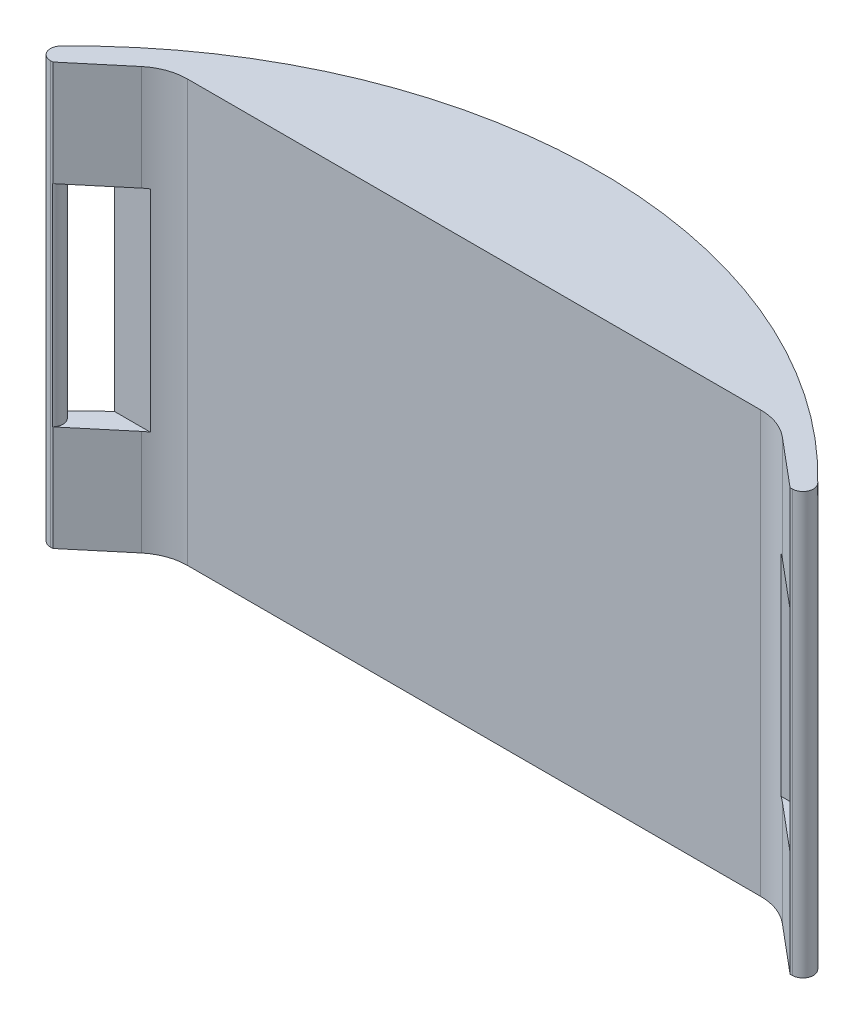
from build123d import *

# Parameters (mm, degrees)
EXTRUDE_4_DEPTH     = 80
CUT_EXTRUDE_1_DEPTH = 80
FILLET_3_R          = 2
FILLET_4_R          = 2
CUT_EXTRUDE_2_DEPTH = 90
CUT_EXTRUDE_3_DEPTH = 90
FILLET_5_R          = 2
FILLET_6_R          = 2


with BuildPart() as part:
    # 草图1 → 凸台-拉伸4 (new body)
    with BuildSketch(Plane(origin=(0, 0, 0), x_dir=(1, 0, 0), z_dir=(0, 1, 0))):
        with BuildLine():
            Line((-58.430824656, -54.95766375), (91.569175344, -54.95766375))
            ThreePointArc((91.569175344, -54.95766375), (16.569175344, -21.101446527), (-58.430824656, -54.95766375))
        make_face()
    extrude(amount=EXTRUDE_4_DEPTH)

    # 草图6 → 切除-拉伸1 (cut)
    with BuildSketch(Plane(origin=(0, 80, 0), x_dir=(1, 0, 0), z_dir=(0, 1, 0))):
        with BuildLine():
            Line((16.569175344, -54.95766375), (-53.430824656, -54.95766375))
            Line((-53.430824656, -54.95766375), (-44.284141383, -47.292975133))
            ThreePointArc((-44.284141383, -47.292975133), (-41.278424436, -45.559608468), (-37.861326704, -44.95766375))
            Line((-37.861326704, -44.95766375), (16.569175344, -44.95766375))
            Line((16.569175344, -44.95766375), (70.999677391, -44.95766375))
            ThreePointArc((70.999677391, -44.95766375), (74.416775124, -45.559608468), (77.422492071, -47.292975133))
            Line((77.422492071, -47.292975133), (86.569175344, -54.95766375))
            Line((86.569175344, -54.95766375), (16.569175344, -54.95766375))
        make_face()
    extrude(amount=-CUT_EXTRUDE_1_DEPTH, mode=Mode.SUBTRACT)

    # 圆角3
    fillet_3_edges = [part.edges().sort_by_distance(p)[0] for p in [
        (-58.430824656, 40, 54.95766375),
    ]]
    fillet(fillet_3_edges, radius=FILLET_3_R)

    # 圆角4
    fillet_4_edges = [part.edges().sort_by_distance(p)[0] for p in [
        (91.569175344, 40, 54.95766375),
    ]]
    fillet(fillet_4_edges, radius=FILLET_4_R)

    # 草图7 → 切除-拉伸2 (cut, symmetric)
    with BuildSketch(Plane(origin=(0, 0, 0), x_dir=(0, 0, -1), z_dir=(1, 0, 0))):
        Polygon((-34.95766375, 20), (-21.101446527, 20), (-21.101446527, 60), (-34.95766375, 60), (-34.95766375, 40), align=None)
    extrude(amount=CUT_EXTRUDE_2_DEPTH, both=True, mode=Mode.SUBTRACT)

    # 草图8 → 切除-拉伸3 (cut, symmetric)
    with BuildSketch(Plane(origin=(0, 0, 0), x_dir=(0, 0, -1), z_dir=(1, 0, 0))):
        Polygon((-46.566974306, 40), (-46.566974306, 20), (-51.566974306, 20), (-51.566974306, 40), (-51.566974306, 60), (-46.566974306, 60), align=None)
    extrude(amount=CUT_EXTRUDE_3_DEPTH, both=True, mode=Mode.SUBTRACT)

    # 圆角5
    # the kernel refuses this fillet: 2 mm, written as the material it takes off along each edge
    with BuildSketch(Plane(origin=(-49.384533414, 20, 51.566974306), x_dir=(-0.7664688616948695, 0, 0.6422814679345583), z_dir=(0, 1, 0))) as fillet_5_piece_1:
        with BuildLine():
            CenterArc((FILLET_5_R * 2.75030333255, -FILLET_5_R), FILLET_5_R, 90, 140.037846047)
            Line((FILLET_5_R * 2.10802186461, -FILLET_5_R * 1.76646886169), (0, 0))
            Line((0, 0), (FILLET_5_R * 2.75030333255, 0))
        make_face()
    extrude(amount=40, mode=Mode.SUBTRACT)

    # 圆角6
    # the kernel refuses this fillet: 2 mm, written as the material it takes off along each edge
    with BuildSketch(Plane(origin=(82.522884101, 60, 51.566974306), x_dir=(1, 0, 0), z_dir=(0, -1, 0))) as fillet_6_piece_1:
        with BuildLine():
            CenterArc((FILLET_6_R * 2.75030333255, FILLET_6_R), FILLET_6_R, 129.962153953, 140.037846047)
            Line((FILLET_6_R * 2.10802186461, FILLET_6_R * 1.76646886169), (0, 0))
            Line((0, 0), (FILLET_6_R * 2.75030333255, 0))
        make_face()
    extrude(amount=40, mode=Mode.SUBTRACT)


solid = part.part
